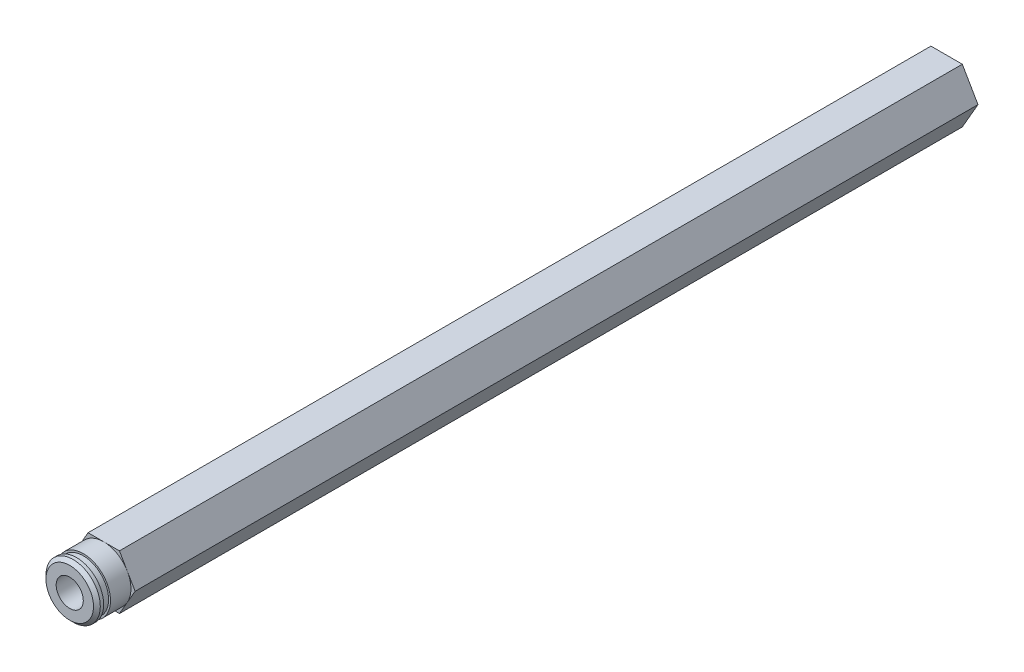
from build123d import *

# Parameters (mm, degrees)
EXTRUSI_N_HEX_PROFILE_DEPTH = 102.465650034
CROQUIS13_R                 = 3.16865
CORTAR_EXTRUIR1_DEPTH       = 9.5504


with BuildPart() as part:
    # Croquis2 → Extrusión Hex Profile (new, symmetric)
    with BuildSketch(Plane.XY):
        Polygon((3.666174209, -6.35), (7.332348419, 0), (3.666174209, 6.35), (-3.666174209, 6.35), (-7.332348419, 0), (-3.666174209, -6.35), align=None)
    extrude(amount=EXTRUSI_N_HEX_PROFILE_DEPTH, both=True)

    # Croquis8 → Retaining Ring 1 (revolve, cut)
    with BuildSketch(Plane(origin=(0, 0, 0), x_dir=(1, 0, 0), z_dir=(0, 1, 0))):
        Polygon((-5.55625, -102.465650034), (-6.35, -101.671900034), (-6.35, -100.878150034), (-5.9055, -100.878150034), (-5.9055, -99.290650034), (-12.7, -99.290650034), (-12.7, -102.465650034), align=None)
    revolve(axis=Axis((0, 0, 102.465650034), (0, 0, -1)), mode=Mode.SUBTRACT)

    # Croquis10 → Round End 1 (revolve, cut)
    with BuildSketch(Plane(origin=(0, 0, 0), x_dir=(1, 0, 0), z_dir=(0, 1, 0))):
        Polygon((-5.55625, -102.465650034), (-6.35, -101.671900034), (-6.35, -94.515450034), (-9.525, -94.515450034), (-9.525, -102.465650034), align=None)
    revolve(axis=Axis((0, 0, 102.465650034), (0, 0, -1)), mode=Mode.SUBTRACT)

    # Croquis13 → Cortar-Extruir1 (cut)
    with BuildSketch(Plane.XY.offset(102.465650034)):
        Circle(CROQUIS13_R)
    extrude(amount=-CORTAR_EXTRUIR1_DEPTH, mode=Mode.SUBTRACT)


solid = part.part
